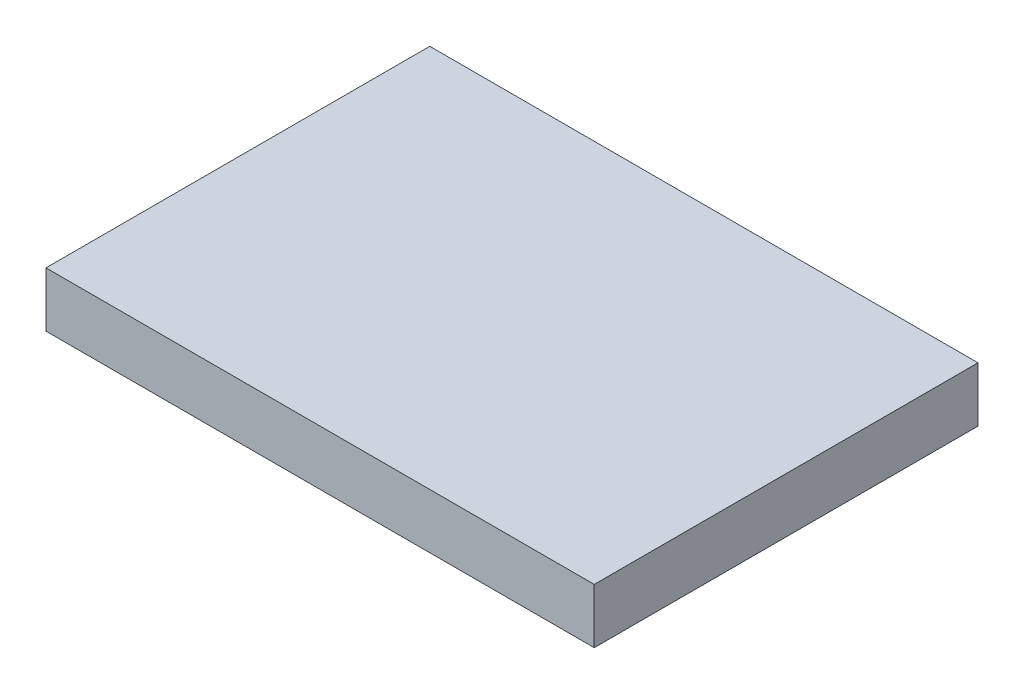
from build123d import *

# Parameters (mm, degrees)
SKETCH1_W           = 300
SKETCH1_H           = 210
BOSS_EXTRUDE1_DEPTH = 15


with BuildPart() as part:
    # Sketch1 → Boss-Extrude1 (new, symmetric)
    with BuildSketch(Plane(origin=(0, 0, 0), x_dir=(1, 0, 0), z_dir=(0, 1, 0))):
        Rectangle(SKETCH1_W, SKETCH1_H)
    extrude(amount=BOSS_EXTRUDE1_DEPTH, both=True)


solid = part.part
